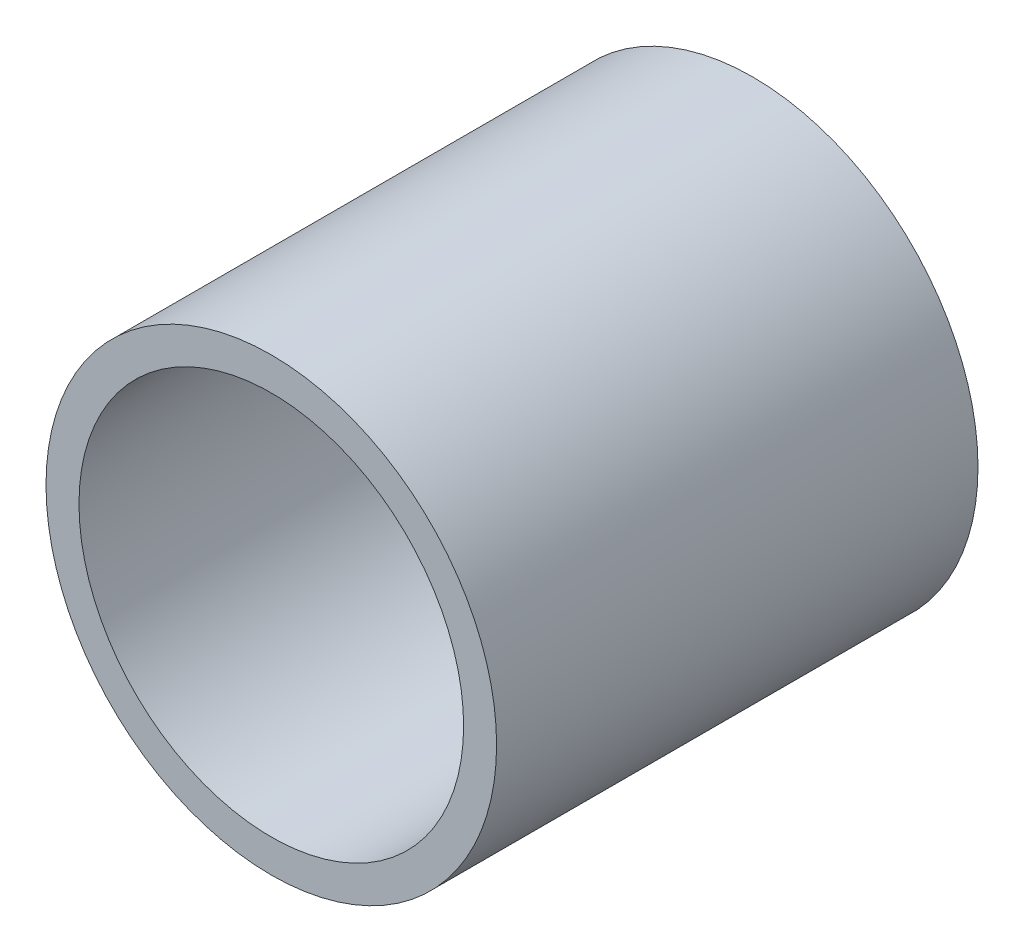
from build123d import *

# Parameters (mm, degrees)
SKETCH1_R      = 9.36
SKETCH1_R_2    = 7.99
EXTRUDE1_DEPTH = 20


with BuildPart() as part:
    # Sketch1 → Extrude1 (new body)
    with BuildSketch(Plane.XY):
        Circle(SKETCH1_R)
        Circle(SKETCH1_R_2, mode=Mode.SUBTRACT)
    extrude(amount=EXTRUDE1_DEPTH)


solid = part.part
